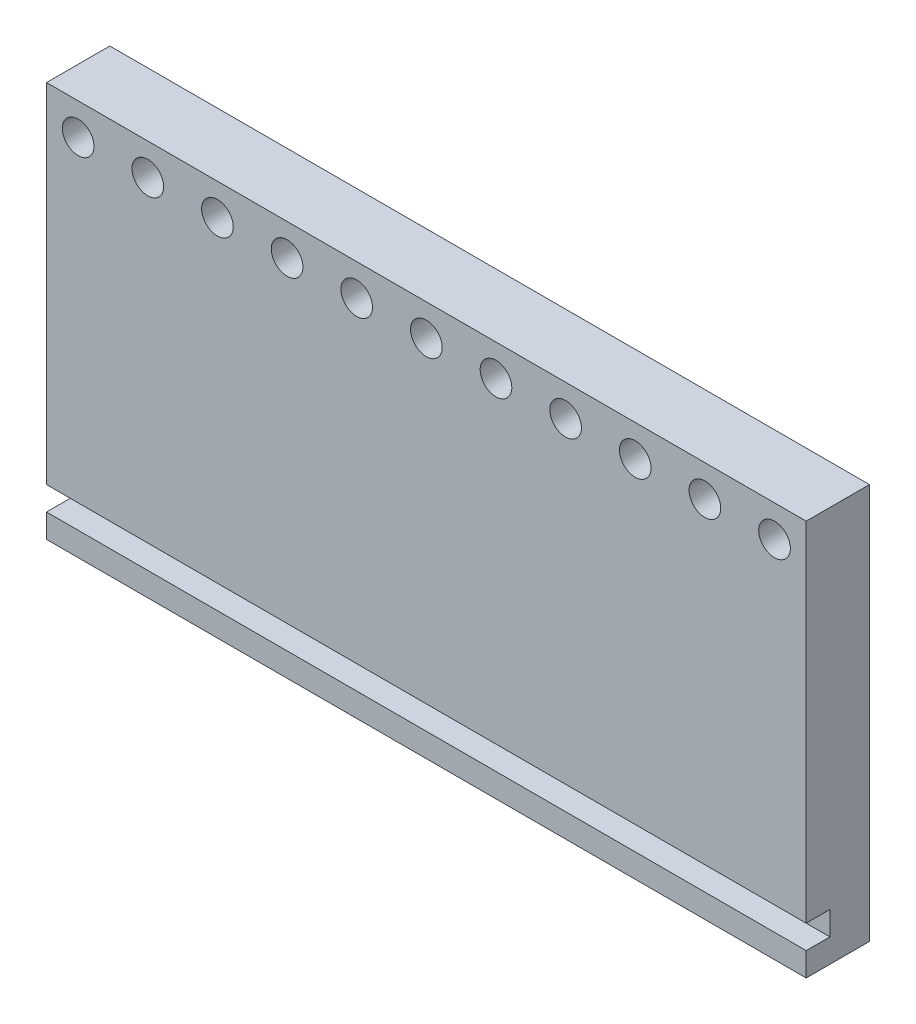
from build123d import *

# Parameters (mm, degrees)
SKETCH1_W           = 304.8
SKETCH1_H           = 25.4
BOSS_EXTRUDE1_DEPTH = 79.375
CUT_EXTRUDE1_REACH  = 317.222
SKETCH2_W           = 9.525
SKETCH2_H           = 9.525
LPATTERN1_COUNT     = 11
LPATTERN1_PITCH     = 27.94


with BuildPart() as part:
    # Sketch1 → Boss-Extrude1 (new, symmetric)
    with BuildSketch(Plane(origin=(0, 0, 0), x_dir=(1, 0, 0), z_dir=(0, 1, 0))):
        Rectangle(SKETCH1_W, SKETCH1_H)
    extrude(amount=BOSS_EXTRUDE1_DEPTH, both=True)

    # Sketch2 → Cut-Extrude1 (cut, up to next)
    with BuildSketch(Plane.ZY.offset(152.4), mode=Mode.PRIVATE) as cut_extrude1_sk1:
        with Locations((7.9375, -65.0875)):
            Rectangle(SKETCH2_W, SKETCH2_H)
    cut_extrude1_tool1 = extrude(cut_extrude1_sk1.sketch, amount=-CUT_EXTRUDE1_REACH, mode=Mode.PRIVATE) & part.part
    add(cut_extrude1_tool1.solids().sort_by_distance((-152.4, -65.0875, 7.9375))[0], mode=Mode.SUBTRACT)

    # Sketch6 → 1/2 (0.5000) Dowel Hole1 (revolve, cut)
    with BuildSketch(Plane(origin=(139.7, 66.675, 12.7), x_dir=(0, -1, 0), z_dir=(1, 0, 0))):
        Polygon((0, 0), (0, 20.325464931), (6.35, 16.51), (6.35, 0), align=None)
    f_1_2_0_5000_dowel_hole1 = revolve(axis=Axis((139.7, 66.675, 19.05), (0, 0, -1)), mode=Mode.SUBTRACT)

    # LPattern1: 1/2 (0.5000) Dowel Hole1 ×11
    with Locations(*[(-i * LPATTERN1_PITCH, 0, 0) for i in range(1, LPATTERN1_COUNT)]):
        add(f_1_2_0_5000_dowel_hole1, mode=Mode.SUBTRACT)


solid = part.part
